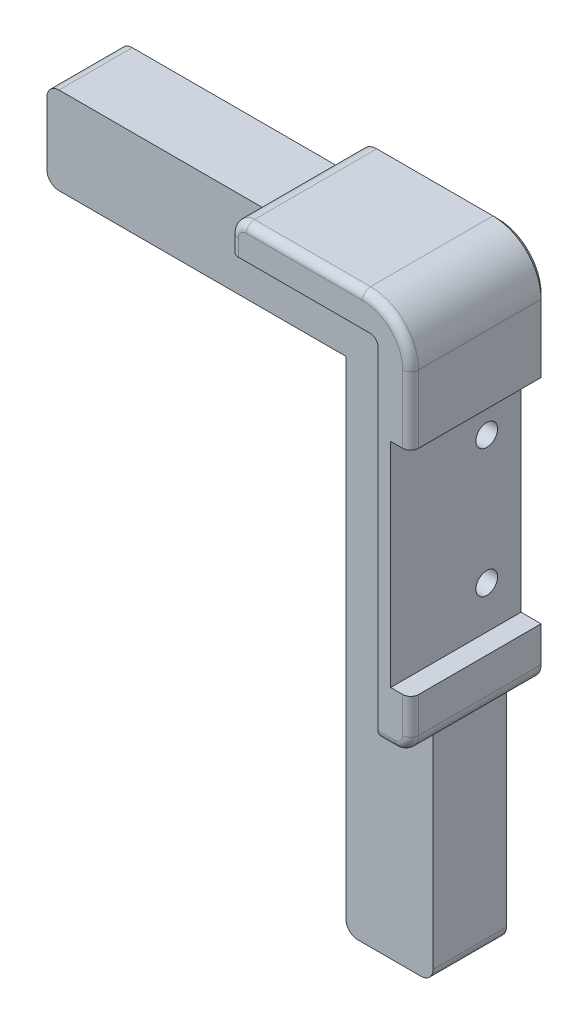
from build123d import *

# Parameters (mm, degrees)
BODY_AND_TONGUES_DEPTH     = 4.875
RIM_DEPTH                  = 8.435
BRACKET_SEAT_SKETCH_W      = 3.5
BRACKET_SEAT_SKETCH_H      = 26.6
BRACKET_SEAT_DEPTH         = 9.435
SCREW_PILOTS_SKETCH_R      = 1.35
SCREW_PILOTS_DEPTH         = 5.5
BUMPER_CORNER_R            = 6
INSIDE_CORNER_OF_THE_RIM_R = 1
RIM_ENDS_R                 = 2
TONGUE_LEAD_IN_R           = 1.5
RIM_TOP_EDGE_R             = 1
BED_FACE_CHAMFER_SIZE      = 0.6


with BuildPart() as part:
    # body and tongues sketch → body and tongues (new, symmetric)
    with BuildSketch(Plane.XY.offset(20.375)):
        Polygon((4.42, 7.07), (-18.08, 7.07), (-18.08, 2.75), (-48.08, 2.75), (-48.08, -8.13), (-10.78, -8.13), (-10.78, -70.43), (0.1, -70.43), (0.1, -40.43), (4.42, -40.43), align=None)
    extrude(amount=BODY_AND_TONGUES_DEPTH, both=True)

    # rim sketch → rim (add, symmetric)
    with BuildSketch(Plane.XY.offset(23.935)):
        Polygon((4.42, 7.07), (-18.08, 7.07), (-18.08, 3), (0.35, 3), (0.35, -40.43), (4.42, -40.43), align=None)
    extrude(amount=RIM_DEPTH, both=True)

    # bracket seat sketch → bracket seat (cut, symmetric)
    with BuildSketch(Plane.XY.offset(23.935)):
        with Locations((3.67, -20.7)):
            Rectangle(BRACKET_SEAT_SKETCH_W, BRACKET_SEAT_SKETCH_H)
    extrude(amount=BRACKET_SEAT_DEPTH, both=True, mode=Mode.SUBTRACT)

    # screw pilots sketch → screw pilots (cut, symmetric)
    with BuildSketch(Plane(origin=(-2.58, 0, 0), x_dir=(0, 0, -1), z_dir=(1, 0, 0))):
        with Locations((-20.375, -28.7)):
            Circle(SCREW_PILOTS_SKETCH_R)
        with Locations((-20.375, -12.7)):
            Circle(SCREW_PILOTS_SKETCH_R)
    extrude(amount=SCREW_PILOTS_DEPTH, both=True, mode=Mode.SUBTRACT)

    # bumper corner
    bumper_corner_edges = [part.edges().sort_by_distance(p)[0] for p in [
        (4.42, 7.07, 23.935),
    ]]
    fillet(bumper_corner_edges, radius=BUMPER_CORNER_R)

    # inside corner of the rim
    inside_corner_of_the_rim_edges = [part.edges().sort_by_distance(p)[0] for p in [
        (0.35, 3, 28.81),
    ]]
    fillet(inside_corner_of_the_rim_edges, radius=INSIDE_CORNER_OF_THE_RIM_R)

    # rim ends
    rim_ends_edges = [part.edges().sort_by_distance(p)[0] for p in [
        (-18.08, 7.07, 23.935),
        (4.42, -40.43, 23.935),
    ]]
    fillet(rim_ends_edges, radius=RIM_ENDS_R)

    # tongue lead-in
    tongue_lead_in_edges = [part.edges().sort_by_distance(p)[0] for p in [
        (-48.08, -8.13, 20.375),
        (-48.08, 2.75, 20.375),
        (-10.78, -70.43, 20.375),
        (0.1, -70.43, 20.375),
    ]]
    fillet(tongue_lead_in_edges, radius=TONGUE_LEAD_IN_R)

    # rim top edge
    rim_top_edge_edges = [part.edges().sort_by_distance(p)[0] for p in [
        (4.42, -36.215, 32.37),
        (2.662640687, 5.312640687, 32.37),
        (-18.08, 4.035, 32.37),
        (-17.494213562, 6.484213562, 32.37),
        (1.385, -40.43, 32.37),
        (3.834213562, -39.844213562, 32.37),
        (-8.83, 7.07, 32.37),
    ]]
    fillet(rim_top_edge_edges, radius=RIM_TOP_EDGE_R)

    # bed face chamfer
    bed_face_chamfer_edges = [part.edges().sort_by_distance(p)[0] for p in [
        (-10.78, -38.53, 15.5),
        (-10.340660172, -69.990660172, 15.5),
        (-5.34, -70.43, 15.5),
        (-0.339339828, -69.990660172, 15.5),
        (0.1, -54.68, 15.5),
        (1.26, -40.43, 15.5),
        (3.834213562, -39.844213562, 15.5),
        (4.42, -3.165, 15.5),
        (3.17, -34, 15.5),
        (1.92, -20.7, 15.5),
        (3.17, -7.4, 15.5),
        (2.662640687, 5.312640687, 15.5),
        (-8.83, 7.07, 15.5),
        (-17.494213562, 6.484213562, 15.5),
        (-18.08, 3.91, 15.5),
        (-32.33, 2.75, 15.5),
        (-47.640660172, 2.310660172, 15.5),
        (-48.08, -2.69, 15.5),
        (-47.640660172, -7.690660172, 15.5),
        (-28.68, -8.13, 15.5),
    ]]
    chamfer(bed_face_chamfer_edges, length=BED_FACE_CHAMFER_SIZE)


solid = part.part
